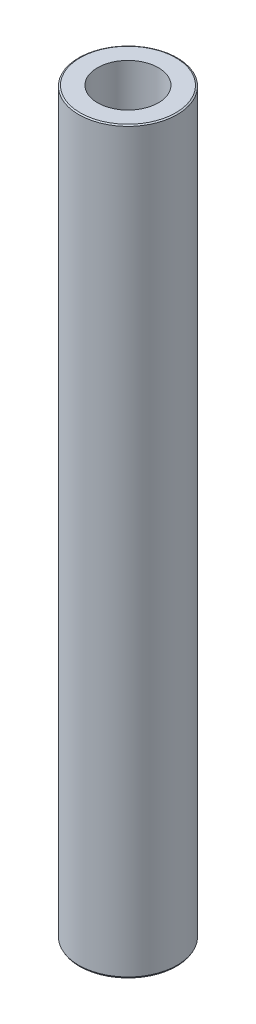
from build123d import *
from OCP.BRepFilletAPI import BRepFilletAPI_MakeChamfer

# Parameters (mm, degrees)
SKETCH1_R           = 22.5
BOSS_EXTRUDE1_DEPTH = 337.705211111
SKETCH2_R           = 13.918132692
CUT_EXTRUDE1_DEPTH  = 340.200987044
CHAMFER1_SIZE       = 0.375645672
CHAMFER1_SIZE2      = 0.6680204


with BuildPart() as part:
    # Sketch1 → Boss-Extrude1 (new body)
    with BuildSketch(Plane(origin=(0, 0, 0), x_dir=(1, 0, 0), z_dir=(0, 1, 0))):
        Circle(SKETCH1_R)
    extrude(amount=BOSS_EXTRUDE1_DEPTH)

    # Sketch2 → Cut-Extrude1 (cut, through all)
    with BuildSketch(Plane(origin=(0, 0, 0), x_dir=(1, 0, 0), z_dir=(0, 1, 0))):
        Circle(SKETCH2_R)
    extrude(amount=CUT_EXTRUDE1_DEPTH, mode=Mode.SUBTRACT)

    # Chamfer1: one chamfer whose edges measure the first distance from different faces: ONE call of the kernel's chamfer builder (chamfer() names one face for all edges)
    chamfer1_edges_1 = [part.edges().sort_by_distance(p)[0] for p in [
        (-22.5, 337.705211111, 0),
    ]]
    chamfer1_side_1 = [part.faces().sort_by_distance(p)[0] for p in [
        (-22.5, 168.852605555, 0),
    ]]
    chamfer1_edges_2 = [part.edges().sort_by_distance(p)[0] for p in [
        (-22.5, 0, 0),
    ]]
    chamfer1_side_2 = [part.faces().sort_by_distance(p)[0] for p in [
        (-21.863603897, 0, 0),
    ]]
    chamfer1 = BRepFilletAPI_MakeChamfer(part.part.solid().wrapped)
    for e in chamfer1_edges_1:
        chamfer1.Add(CHAMFER1_SIZE, CHAMFER1_SIZE2, e.wrapped, chamfer1_side_1[0].wrapped)  # the first distance lies on this face
    for e in chamfer1_edges_2:
        chamfer1.Add(CHAMFER1_SIZE, CHAMFER1_SIZE2, e.wrapped, chamfer1_side_2[0].wrapped)  # the first distance lies on this face
    add(Compound.cast(chamfer1.Shape()), mode=Mode.REPLACE)


solid = part.part
